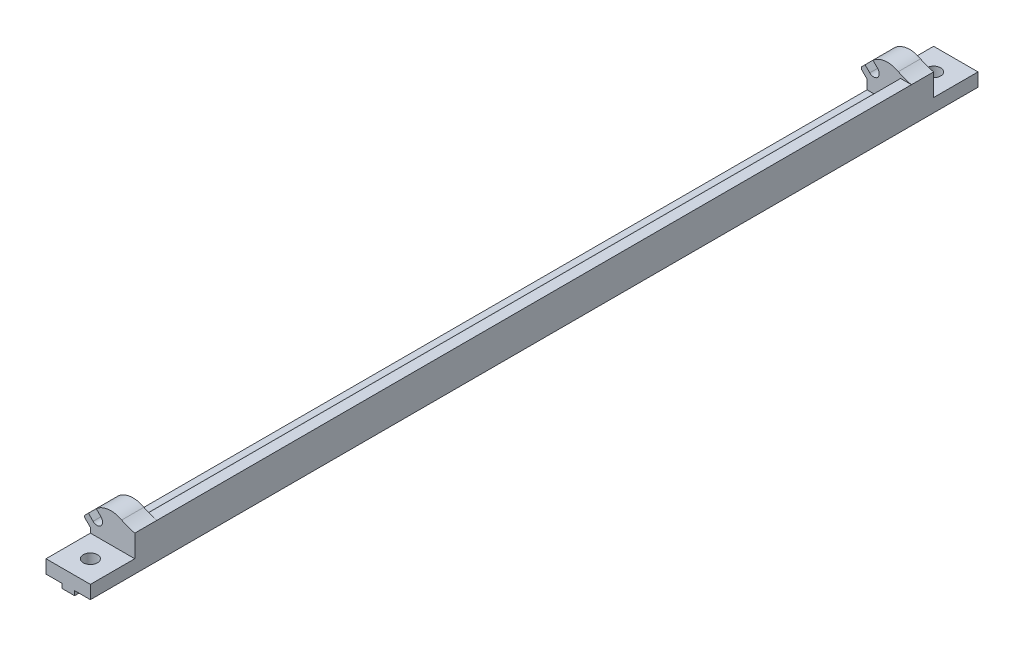
from build123d import *

# Parameters (mm, degrees)
MAIN_DEPTH                  = 100
FIXFORROLLINGCYLINDER_DEPTH = 5
SKETCH4_W                   = 10
SKETCH4_H                   = 10
HORIZONTALCUT_DEPTH         = 10
SKETCH7_W                   = 10
SKETCH7_H                   = 10
BOSS_EXTRUDE1_DEPTH         = 1
MAKERBEAMHOLE_DEPTH         = 101.931998276
MAKERBEAMHOLE_DEPTH_BACK    = 101.931998276
SKETCH5_R                   = 1.6
FILLET1_R                   = 10
FILLET2_R                   = 5
FILLET3_R                   = 0.5


with BuildPart() as part:
    # Sketch1 → Main (new body)
    with BuildSketch(Plane.XY):
        with BuildLine():
            Line((0, 0), (3.55, 0))
            Line((3.55, 0), (3.55, -1))
            Line((3.55, -1), (6.45, -1))
            Line((6.45, -1), (6.45, 0))
            Line((6.45, 0), (10, 0))
            Line((10, 0), (10, 8))
            Line((10, 8), (7.562177826, 8))
            Line((7.562177826, 8), (5.397114317, 4.25))
            ThreePointArc((5.397114317, 4.25), (3.75, 2.602885683), (1.5, 2))
            Line((1.5, 2), (0, 2))
            Line((0, 2), (0, 0))
        make_face()
    extrude(amount=MAIN_DEPTH)

    # Sketch3 → FixForRollingCylinder (add)
    with BuildSketch(Plane.XY.offset(90)):
        with BuildLine():
            Line((-1.50520382, 5.616116524), (0, 4.110912703))
            Line((0, 4.110912703), (0, 0))
            Line((0, 0), (10, 0))
            Line((10, 0), (10, 8))
            Line((10, 8), (7.562177826, 8))
            Line((7.562177826, 8), (4.220428741, 11.341749085))
            Line((4.220428741, 11.341749085), (1.323223305, 8.444543648))
            Line((1.323223305, 8.444543648), (2.383883476, 7.383883476))
            ThreePointArc((2.383883476, 7.383883476), (2.383883476, 5.616116524), (0.616116524, 5.616116524))
            Line((0.616116524, 5.616116524), (-0.444543648, 6.676776695))
            Line((-0.444543648, 6.676776695), (-1.50520382, 5.616116524))
        make_face()
    extrude(amount=-FIXFORROLLINGCYLINDER_DEPTH)

    # Sketch4 → HorizontalCut (cut)
    with BuildSketch(Plane(origin=(0, 3, 0), x_dir=(1, 0, 0), z_dir=(0, 1, 0))):
        with Locations((5, -95)):
            Rectangle(SKETCH4_W, SKETCH4_H)
    extrude(amount=HORIZONTALCUT_DEPTH, mode=Mode.SUBTRACT)

    # Sketch7 → Boss-Extrude1 (add)
    with BuildSketch(Plane(origin=(0, 3, 0), x_dir=(1, 0, 0), z_dir=(0, 1, 0))):
        with Locations((5, -95)):
            Rectangle(SKETCH7_W, SKETCH7_H)
    extrude(amount=-BOSS_EXTRUDE1_DEPTH)

    # Sketch5 → MakerBeamHole (cut, two sides: drawn at the far end of the back side and taken through both)
    with BuildSketch(Plane(origin=(0, 2, 0), x_dir=(1, 0, 0), z_dir=(0, 1, 0)).offset(-MAKERBEAMHOLE_DEPTH_BACK)):
        with Locations(Location((5, -95, 0), (0, 0, 25.007833235))):
            Circle(SKETCH5_R)
    extrude(amount=MAKERBEAMHOLE_DEPTH + MAKERBEAMHOLE_DEPTH_BACK, mode=Mode.SUBTRACT)

    # Mirror1: part across plane


with BuildPart() as part_1:
    add(part.part)
    add(part.part.mirror(Plane.XY))

    # Fillet1
    # the kernel refuses this fillet: 10 mm, written as the material it adds along each edge
    with BuildSketch(Plane(origin=(7.562177826, 8, -90), x_dir=(-0.7071067811865462, 0.7071067811865489, 0), z_dir=(0, 0, 1))) as fillet1_piece_1:
        with BuildLine():
            CenterArc((3.889088446, -10), FILLET1_R, 90, 34.144980958)
            Line((-1.72380059, -1.72380059), (0, 0))
            Line((0, 0), (3.889088446, 0))
        make_face()
    extrude(amount=5)
    with BuildSketch(Plane(origin=(7.562177826, 8, 90), x_dir=(-0.7071067811865462, 0.7071067811865489, 0), z_dir=(0, 0, -1))) as fillet1_piece_2:
        with BuildLine():
            CenterArc((3.889088446, 10), FILLET1_R, 235.855019042, 34.144980958)
            Line((-1.72380059, 1.72380059), (0, 0))
            Line((0, 0), (3.889088446, 0))
        make_face()
    extrude(amount=5)

    # Fillet2
    # the kernel refuses this fillet: 5 mm, written as the material it takes off along each edge
    with BuildSketch(Plane(origin=(4.220428741, 11.341749085, -100.243168054), x_dir=(0.7792084739241206, -0.6267648316273362, 0), z_dir=(0, 0, 1))) as fillet2_piece_1:
        with BuildLine():
            CenterArc((4.485150557, -4.925762162), FILLET2_R, 99.885624433, 70.299011634)
            Line((-0.441660549, -4.073393505), (-0.93434166, -3.988156639))
            ThreePointArc((-0.93434166, -3.988156639), (-0.717916904, -1.982799786), (-0.497086629, 0.053896967))
            Line((-0.497086629, 0.053896967), (0.053896967, 0.497086629))
            ThreePointArc((0.053896967, 0.497086629), (0.885879241, 0.406878367), (3.540899942, 0.492576216))
            Line((3.540899942, 0.492576216), (3.626740907, 0))
        make_face()
    extrude(amount=25.486336108, mode=Mode.SUBTRACT)
    with BuildSketch(Plane(origin=(4.220428741, 11.341749085, 100.243168054), x_dir=(0.7792084739241207, -0.626764831627336, 0), z_dir=(0, 0, -1))) as fillet2_piece_2:
        with BuildLine():
            CenterArc((4.485150557, 4.925762162), FILLET2_R, 189.815363933, 70.299011634)
            Line((-0.441660549, 4.073393505), (-0.93434166, 3.988156639))
            ThreePointArc((-0.93434166, 3.988156639), (-0.717916904, 1.982799786), (-0.497086629, -0.053896967))
            Line((-0.497086629, -0.053896967), (0.053896967, -0.497086629))
            ThreePointArc((0.053896967, -0.497086629), (0.885879241, -0.406878367), (3.540899942, -0.492576216))
            Line((3.540899942, -0.492576216), (3.626740907, 0))
        make_face()
    extrude(amount=25.486336108, mode=Mode.SUBTRACT)

    # Fillet3
    fillet3_edges = [part_1.edges().sort_by_distance(p)[0] for p in [
        (-1.50520382, 5.616116524, -87.5),
        (-1.50520382, 5.616116524, 87.5),
    ]]
    fillet(fillet3_edges, radius=FILLET3_R)


solid = part_1.part
